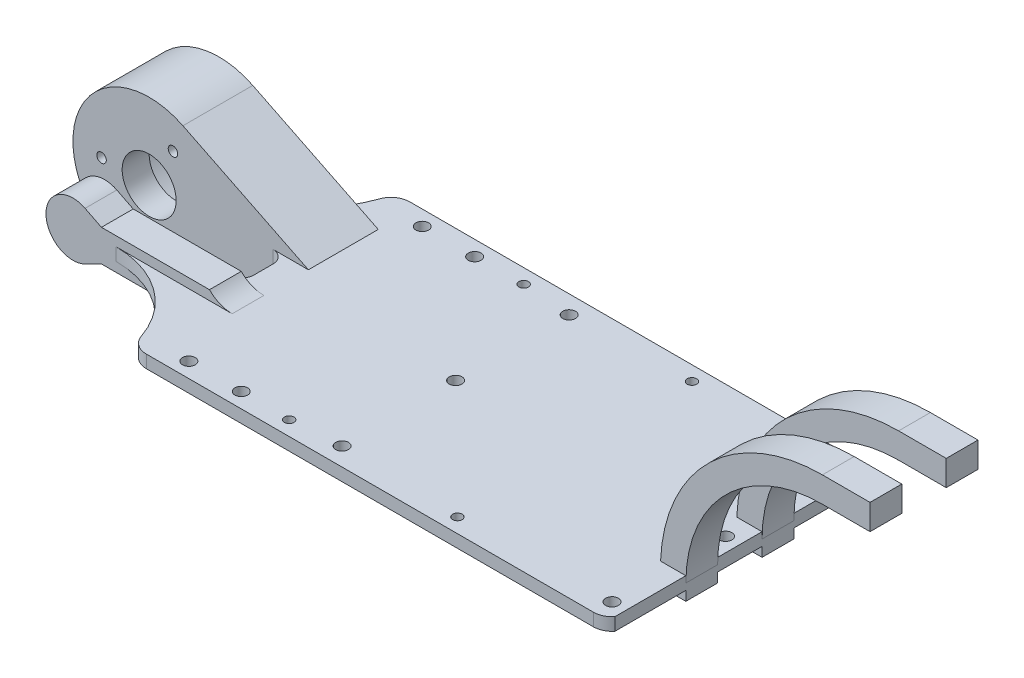
from build123d import *

# Parameters (mm, degrees)
SKETCH1_W                = 49
SKETCH1_H                = 10
BOSS_EXTRUDE1_DEPTH      = 5
BOSS_EXTRUDE1_2_DEPTH    = 5
BOSS_EXTRUDE1_3_DEPTH    = 5
BOSS_EXTRUDE1_4_DEPTH    = 5
CUT_EXTRUDE7_DEPTH       = 129.674006699
CUT_EXTRUDE7_DEPTH_BACK  = 129.674006699
SKETCH2_R                = 2
SKETCH1_3_W              = 150
SKETCH1_3_H              = 83
SKETCH1_3_R              = 2
SKETCH1_3_R_2            = 1.5
BOSS_EXTRUDE2_DEPTH      = 2
FILLET1_R                = 10
SKETCH3_W                = 150
SKETCH3_H                = 10
BOSS_EXTRUDE3_DEPTH      = 3
FILLET2_R                = 30
FILLET3_R                = 4
FILLET4_R                = 6
CUT_EXTRUDE8_DEPTH       = 131.000961535
CUT_EXTRUDE8_DEPTH_BACK  = 131.000961535
SKETCH4_R                = 2
CUT_EXTRUDE11_DEPTH      = 10
CUT_EXTRUDE11_DEPTH_BACK = 10
SKETCH7_W                = 28.430899549
SKETCH7_H                = 10.310755735
BOSS_EXTRUDE4_START      = -10
SKETCH6_R                = 21.075
SKETCH6_R_2              = 1.5
SKETCH6_R_3              = 8.5
BOSS_EXTRUDE4_DEPTH      = 22
SKETCH9_R                = 2
BOSS_EXTRUDE5_DEPTH      = 10
CUT_EXTRUDE12_START      = -10
SKETCH9_4_R              = 2
CUT_EXTRUDE12_DEPTH      = 4.2
CUT_EXTRUDE13_START      = -1.5
SKETCH6_3_R              = 21.075
SKETCH6_3_R_2            = 1.5
SKETCH6_3_R_3            = 8.5
CUT_EXTRUDE13_DEPTH      = 13.5
CUT_EXTRUDE14_DEPTH      = 151.207356677
CUT_EXTRUDE14_DEPTH_BACK = 151.207356677
SKETCH11_W               = 48
SKETCH11_H               = 83
BOSS_EXTRUDE6_START      = 7
BOSS_EXTRUDE6_DEPTH      = 10
BOSS_EXTRUDE7_START      = -17
BOSS_EXTRUDE7_DEPTH      = 10


with BuildPart() as part:
    # Sketch1 → Boss-Extrude1 (new, symmetric)
    with BuildSketch(Plane(origin=(0, 0, 0), x_dir=(1, 0, 0), z_dir=(0, 1, 0))):
        with Locations((-99.5, 12)):
            Rectangle(SKETCH1_W, SKETCH1_H)
    extrude(amount=BOSS_EXTRUDE1_DEPTH, both=True)


with BuildPart() as body_2:
    # Sketch1 → Boss-Extrude1 2 (new, symmetric)
    with BuildSketch(Plane(origin=(0, 0, 0), x_dir=(1, 0, 0), z_dir=(0, 1, 0))):
        with Locations((-99.5, -12)):
            Rectangle(SKETCH1_W, SKETCH1_H)
    extrude(amount=BOSS_EXTRUDE1_2_DEPTH, both=True)


with BuildPart() as body_3:
    # Sketch1 → Boss-Extrude1 3 (new, symmetric)
    with BuildSketch(Plane(origin=(0, 0, 0), x_dir=(1, 0, 0), z_dir=(0, 1, 0))):
        with Locations((99.5, 12)):
            Rectangle(SKETCH1_W, SKETCH1_H)
    extrude(amount=BOSS_EXTRUDE1_3_DEPTH, both=True)


with BuildPart() as body_4:
    # Sketch1 → Boss-Extrude1 4 (new, symmetric)
    with BuildSketch(Plane(origin=(0, 0, 0), x_dir=(1, 0, 0), z_dir=(0, 1, 0))):
        with Locations((99.5, -12)):
            Rectangle(SKETCH1_W, SKETCH1_H)
    extrude(amount=BOSS_EXTRUDE1_4_DEPTH, both=True)


with BuildPart() as cut_extrude7_tool:
    # Sketch2 → Cut-Extrude7 (new, two sides: drawn at the far end of the back side and taken through both)
    with BuildSketch(Plane(origin=(0, 0, -17), x_dir=(-1, 0, 0), z_dir=(0, 0, -1)).offset(-CUT_EXTRUDE7_DEPTH_BACK)):
        with Locations((-118, 0)):
            Circle(SKETCH2_R)
        with Locations((118, 0)):
            Circle(SKETCH2_R)
        with BuildLine():
            Line((-118, 5), (-118, 9.505708739))
            Line((-118, 9.505708739), (-152.726369059, 9.505708739))
            Line((-152.726369059, 9.505708739), (-152.726369059, -6.904283851))
            Line((-152.726369059, -6.904283851), (-118, -6.904283851))
            Line((-118, -6.904283851), (-118, -5))
            ThreePointArc((-118, -5), (-123, 0), (-118, 5))
        make_face()
        with BuildLine():
            Line((118, 5), (118, 9.505708739))
            Line((118, 9.505708739), (152.726369059, 9.505708739))
            Line((152.726369059, 9.505708739), (152.726369059, -6.904283851))
            Line((152.726369059, -6.904283851), (118, -6.904283851))
            Line((118, -6.904283851), (118, -5))
            ThreePointArc((118, -5), (123, 0), (118, 5))
        make_face()
    extrude(amount=CUT_EXTRUDE7_DEPTH + CUT_EXTRUDE7_DEPTH_BACK)


with BuildPart() as part_1:
    add(part.part)

    # Cut-Extrude7: cut by cut_extrude7_tool
    add(cut_extrude7_tool.part, mode=Mode.SUBTRACT)



with BuildPart() as body_2_1:
    add(body_2.part)

    # Cut-Extrude7: cut by cut_extrude7_tool
    add(cut_extrude7_tool.part, mode=Mode.SUBTRACT)


with BuildPart() as body_3_1:
    add(body_3.part)

    # Cut-Extrude7: cut by cut_extrude7_tool
    add(cut_extrude7_tool.part, mode=Mode.SUBTRACT)


with BuildPart() as body_4_1:
    add(body_4.part)

    # Cut-Extrude7: cut by cut_extrude7_tool
    add(cut_extrude7_tool.part, mode=Mode.SUBTRACT)


with BuildPart() as part_2:
    add(part_1.part)

    add(body_2_1.part)  # Boss-Extrude2 merges body 2

    add(body_3_1.part)  # Boss-Extrude2 merges body 3

    add(body_4_1.part)  # Boss-Extrude2 merges body 4
    # Sketch1<3> → Boss-Extrude2 (add, symmetric)
    with BuildSketch(Plane(origin=(0, 0, 0), x_dir=(1, 0, 0), z_dir=(0, 1, 0))):
        Rectangle(SKETCH1_3_W, SKETCH1_3_H)
        with Locations(Location((70.5, 35.75, 0), (0, 0, 270))):
            Circle(SKETCH1_3_R, mode=Mode.SUBTRACT)
        with Locations(Location((70.5, 0, 0), (0, 0, 270))):
            Circle(SKETCH1_3_R, mode=Mode.SUBTRACT)
        with Locations(Location((70.5, -35.75, 0), (0, 0, 270))):
            Circle(SKETCH1_3_R, mode=Mode.SUBTRACT)
        with Locations(Location((-14.5, -35.75, 0), (0, 0, 270))):
            Circle(SKETCH1_3_R, mode=Mode.SUBTRACT)
        with Locations(Location((-14.5, 0, 0), (0, 0, 270))):
            Circle(SKETCH1_3_R, mode=Mode.SUBTRACT)
        with Locations(Location((-14.5, 35.75, 0), (0, 0, 270))):
            Circle(SKETCH1_3_R, mode=Mode.SUBTRACT)
        with Locations(Location((-30, -36.93, 0), (0, 0, 270))):
            Circle(SKETCH1_3_R_2, mode=Mode.SUBTRACT)
        with Locations(Location((23, -36.93, 0), (0, 0, 270))):
            Circle(SKETCH1_3_R_2, mode=Mode.SUBTRACT)
        with Locations(Location((23, 36.93, 0), (0, 0, 270))):
            Circle(SKETCH1_3_R_2, mode=Mode.SUBTRACT)
        with Locations(Location((-30, 36.93, 0), (0, 0, 270))):
            Circle(SKETCH1_3_R_2, mode=Mode.SUBTRACT)
    extrude(amount=BOSS_EXTRUDE2_DEPTH, both=True)

    # Fillet1
    # the kernel refuses this fillet: 10 mm, written as the material it adds along each edge
    with BuildSketch(Plane(origin=(-75, 2, -17), x_dir=(0, 1, 0), z_dir=(0, 0, 1))) as fillet1_piece_1:
        with BuildLine():
            CenterArc((10, -7.141428429), FILLET1_R, 134.427004001, 45.572995999)
            Line((0, -7.141428429), (0, 0))
            Line((0, 0), (3, 0))
        make_face()
    extrude(amount=10)
    with BuildSketch(Plane(origin=(-75, 2, -34.853571071), x_dir=(0, 1, 0), z_dir=(0, 0, 1))) as fillet1_piece_2_section:
        with BuildLine():
            CenterArc((10, -7.141428429), FILLET1_R, 134.427004001, 45.572995999)
            Line((0, -7.141428429), (0, 0))
            Line((0, 0), (3, 0))
        make_face()
    fillet1_piece_2 = extrude(amount=45.707142143, mode=Mode.PRIVATE)
    fillet1_piece_2 = split(fillet1_piece_2, bisect_by=Plane(origin=(-71.739300884, 2.762016454, 7), z_dir=(0, 0, 1)), keep=Keep.TOP, mode=Mode.PRIVATE)
    add(fillet1_piece_2)
    with BuildSketch(Plane(origin=(-75, 2, -10.853571071), x_dir=(1, 0, 0), z_dir=(0, 0, 1))) as fillet1_piece_3_section:
        with BuildLine():
            CenterArc((7.141428429, 10), FILLET1_R, 224.427004001, 45.572995999)
            Line((0, 3), (0, 0))
            Line((0, 0), (7.141428429, 0))
        make_face()
    fillet1_piece_3 = extrude(amount=45.707142143, mode=Mode.PRIVATE)
    fillet1_piece_3 = split(fillet1_piece_3, bisect_by=Plane(origin=(-71.739300884, 2.762016454, -7), z_dir=(0, 0, -1)), keep=Keep.TOP, mode=Mode.PRIVATE)
    add(fillet1_piece_3)
    with BuildSketch(Plane(origin=(-75, 2, 7), x_dir=(1, 0, 0), z_dir=(0, 0, 1)), Plane(origin=(75, 2, 17), x_dir=(-1, 0, 0), z_dir=(0, 0, -1)), Plane(origin=(75, 2, -7), x_dir=(-1, 0, 0), z_dir=(0, 0, -1))) as fillet1_piece_4:
        with BuildLine():
            CenterArc((7.141428429, 10), FILLET1_R, 224.427004001, 45.572995999)
            Line((0, 3), (0, 0))
            Line((0, 0), (7.141428429, 0))
        make_face()
    extrude(amount=10)
    with BuildSketch(Plane(origin=(75, 2, 34.853571071), x_dir=(-1, 0, 0), z_dir=(0, 0, -1))) as fillet1_piece_5_section:
        with BuildLine():
            CenterArc((7.141428429, 10), FILLET1_R, 224.427004001, 45.572995999)
            Line((0, 3), (0, 0))
            Line((0, 0), (7.141428429, 0))
        make_face()
    fillet1_piece_5 = extrude(amount=45.707142143, mode=Mode.PRIVATE)
    fillet1_piece_5 = split(fillet1_piece_5, bisect_by=Plane(origin=(71.739300884, 2.762016454, -7), z_dir=(0, 0, -1)), keep=Keep.TOP, mode=Mode.PRIVATE)
    add(fillet1_piece_5)
    with BuildSketch(Plane(origin=(75, 2, 10.853571071), x_dir=(-1, 0, 0), z_dir=(0, 0, -1))) as fillet1_piece_6_section:
        with BuildLine():
            CenterArc((7.141428429, 10), FILLET1_R, 224.427004001, 45.572995999)
            Line((0, 3), (0, 0))
            Line((0, 0), (7.141428429, 0))
        make_face()
    fillet1_piece_6 = extrude(amount=45.707142143, mode=Mode.PRIVATE)
    fillet1_piece_6 = split(fillet1_piece_6, bisect_by=Plane(origin=(71.739300884, 2.762016454, 7), z_dir=(0, 0, 1)), keep=Keep.TOP, mode=Mode.PRIVATE)
    add(fillet1_piece_6)

    # Sketch3 → Boss-Extrude3 (add)
    with BuildSketch(Plane.XZ.offset(2)):
        with Locations((0, 12)):
            Rectangle(SKETCH3_W, SKETCH3_H)
        with Locations((0, -12)):
            Rectangle(SKETCH3_W, SKETCH3_H)
    extrude(amount=BOSS_EXTRUDE3_DEPTH)

    # Fillet2
    # the kernel refuses this fillet: 30 mm, written as the material it adds along each edge
    with BuildSketch(Plane(origin=(-75, 2, 17), x_dir=(-1, 0, 0), z_dir=(0, -1, 0)), Plane(origin=(75, -2, 17), x_dir=(1, 0, 0), z_dir=(0, 1, 0))) as fillet2_piece_1:
        with BuildLine():
            CenterArc((29.491524206, -30), FILLET2_R, 90, 79.436022411)
            Line((0, -24.5), (-0.589830484, -24.39))
            ThreePointArc((-0.589830484, -24.39), (-0.6, -12.25), (-0.6, 0))
            Line((-0.6, 0), (0, 0.6))
            Line((0, 0.6), (29.491524206, 0.6))
            Line((29.491524206, 0.6), (29.491524206, 0))
        make_face()
    extrude(amount=4)
    with BuildSketch(Plane(origin=(-75, -2, -17), x_dir=(0, 0, -1), z_dir=(0, 1, 0)), Plane(origin=(75, 2, -17), x_dir=(0, 0, -1), z_dir=(0, -1, 0))) as fillet2_piece_2:
        with BuildLine():
            CenterArc((30, 29.491524206), FILLET2_R, 180, 79.436022411)
            Line((0, 29.491524206), (-0.6, 29.491524206))
            Line((-0.6, 29.491524206), (-0.6, 0))
            Line((-0.6, 0), (0, -0.6))
            ThreePointArc((0, -0.6), (12.25, -0.6), (24.39, -0.589830484))
            Line((24.39, -0.589830484), (24.5, 0))
        make_face()
    extrude(amount=4)

    # Fillet3
    fillet3_edges = [part_2.edges().sort_by_distance(p)[0] for p in [
        (-75, 0, 7),
        (75, 0, -7),
        (75, 0, 7),
        (-75, 0, -7),
    ]]
    fillet(fillet3_edges, radius=FILLET3_R)

    # Fillet4
    fillet4_edges = [part_2.edges().sort_by_distance(p)[0] for p in [
        (-75, 0, -41.5),
        (-75, 0, 41.5),
        (75, 0, 41.5),
        (75, 0, -41.5),
    ]]
    fillet(fillet4_edges, radius=FILLET4_R)

    # Sketch4 → Cut-Extrude8 (cut, two sides: drawn at the far end of the back side and taken through both)
    with BuildSketch(Plane(origin=(0, 2, 0), x_dir=(1, 0, 0), z_dir=(0, 1, 0)).offset(-CUT_EXTRUDE8_DEPTH_BACK)):
        with Locations(Location((-45.25, -36.75, 0), (0, 0, 270))):
            Circle(SKETCH4_R)
        with Locations(Location((-61.75, -36.75, 0), (0, 0, 270))):
            Circle(SKETCH4_R)
        with Locations(Location((-45.25, 36.75, 0), (0, 0, 270))):
            Circle(SKETCH4_R)
        with Locations(Location((-61.75, 36.75, 0), (0, 0, 270))):
            Circle(SKETCH4_R)
    extrude(amount=CUT_EXTRUDE8_DEPTH + CUT_EXTRUDE8_DEPTH_BACK, mode=Mode.SUBTRACT)

    # Sketch7 → Cut-Extrude11 (cut, two sides: drawn at the far end of the back side and taken through both)
    with BuildSketch(Plane(origin=(0, 0, -17), x_dir=(-1, 0, 0), z_dir=(0, 0, -1)).offset(-CUT_EXTRUDE11_DEPTH_BACK)):
        with Locations((109.035286033, -0.155377868)):
            Rectangle(SKETCH7_W, SKETCH7_H)
    extrude(amount=CUT_EXTRUDE11_DEPTH + CUT_EXTRUDE11_DEPTH_BACK, mode=Mode.SUBTRACT)

    # Sketch6 → Boss-Extrude4 (add)
    # profile 1 of 6: a face of its own
    with BuildSketch(Plane(origin=(0, 0, -17), x_dir=(-1, 0, 0), z_dir=(0, 0, -1)).offset(BOSS_EXTRUDE4_START)):
        with BuildLine():
            ThreePointArc((142, 0), (130.666861261, 20.385058886), (107.370781183, 21.517892726))
            ThreePointArc((107.370781183, 21.517892726), (97.104429588, 11.805724763), (94.083478514, -2))
            Line((94.083478514, -2), (94.819836258, -2))
            Line((94.819836258, -2), (94.819836258, -5))
            Line((94.819836258, -5), (94.526610811, -5))
            ThreePointArc((94.526610811, -5), (99.053835132, -14.732373766), (107.370781183, -21.517892726))
            ThreePointArc((107.370781183, -21.517892726), (130.666861261, -20.385058886), (142, 0))
        make_face()
        with Locations((118, 0)):
            Circle(SKETCH6_R, mode=Mode.SUBTRACT)
    # profile 2 of 6: a face of its own
    with BuildSketch(Plane(origin=(0, 0, -17), x_dir=(-1, 0, 0), z_dir=(0, 0, -1)).offset(BOSS_EXTRUDE4_START)):
        with Locations((118, 0)):
            Circle(SKETCH6_R)
        with Locations(Location((110.5, -12.990381057, 0), (0, 0, 180))):
            Circle(SKETCH6_R_2, mode=Mode.SUBTRACT)
        with Locations(Location((110.5, 12.990381057, 0), (0, 0, 180))):
            Circle(SKETCH6_R_2, mode=Mode.SUBTRACT)
        with Locations(Location((133, 0, 0), (0, 0, 180))):
            Circle(SKETCH6_R_2, mode=Mode.SUBTRACT)
        with Locations(Location((118, 0, 0), (0, 0, 180))):
            Circle(SKETCH6_R_3, mode=Mode.SUBTRACT)
    # profile 3 of 6: a face of its own
    with BuildSketch(Plane(origin=(0, 0, -17), x_dir=(-1, 0, 0), z_dir=(0, 0, -1)).offset(BOSS_EXTRUDE4_START)):
        with BuildLine():
            Line((73.931800403, -5), (107.370781183, -21.517892726))
            ThreePointArc((107.370781183, -21.517892726), (99.053835132, -14.732373766), (94.526610811, -5))
            Line((94.526610811, -5), (73.931800403, -5))
        make_face()
    # profile 4 of 6: a face of its own
    with BuildSketch(Plane(origin=(0, 0, -17), x_dir=(-1, 0, 0), z_dir=(0, 0, -1)).offset(BOSS_EXTRUDE4_START)):
        with BuildLine():
            ThreePointArc((94.083478514, -2), (97.104429588, 11.805724763), (107.370781183, 21.517892726))
            Line((107.370781183, 21.517892726), (67.858571571, 2))
            Line((67.858571571, 2), (67.858571571, -2))
            Line((67.858571571, -2), (94.083478514, -2))
        make_face()
    # profile 5 of 6: a face of its own
    with BuildSketch(Plane(origin=(0, 0, -17), x_dir=(-1, 0, 0), z_dir=(0, 0, -1)).offset(BOSS_EXTRUDE4_START)):
        with BuildLine():
            ThreePointArc((94.526610811, -5), (94.257613674, -3.507006068), (94.083478514, -2))
            Line((94.083478514, -2), (67.858571571, -2))
            Line((67.858571571, -2), (73.931800403, -5))
            Line((73.931800403, -5), (94.526610811, -5))
        make_face()
    # profile 6 of 6: a face of its own
    with BuildSketch(Plane(origin=(0, 0, -17), x_dir=(-1, 0, 0), z_dir=(0, 0, -1)).offset(BOSS_EXTRUDE4_START)):
        with BuildLine():
            Line((94.819836258, -2), (94.083478514, -2))
            ThreePointArc((94.083478514, -2), (94.257613674, -3.507006068), (94.526610811, -5))
            Line((94.526610811, -5), (94.819836258, -5))
            Line((94.819836258, -5), (94.819836258, -2))
        make_face()
    extrude(amount=BOSS_EXTRUDE4_DEPTH)

    # Sketch9 → Boss-Extrude5 (add)
    # profile 1 of 10: a face of its own
    with BuildSketch(Plane.XY.offset(17)):
        with BuildLine():
            Line((-103.054202201, 2), (-109.021632678, 5))
            Line((-109.021632678, 5), (-111.126136458, 5))
            ThreePointArc((-111.126136458, 5), (-109.91675065, 2.628893293), (-109.5, 0))
            ThreePointArc((-109.5, 0), (-109.91675065, -2.628893293), (-111.126136458, -5))
            Line((-111.126136458, -5), (-109.021632678, -5))
            Line((-109.021632678, -5), (-103.054202201, -2))
            Line((-103.054202201, -2), (-104.491524206, -2))
            Line((-104.491524206, -2), (-104.491524206, 2))
            Line((-104.491524206, 2), (-103.054202201, 2))
        make_face()
    # profile 2 of 10: a face of its own
    with BuildSketch(Plane.XY.offset(17)):
        with BuildLine():
            ThreePointArc((-111.126136458, 5), (-112.498999561, 6.479891524), (-114.182113913, 7.594323263))
            ThreePointArc((-114.182113913, 7.594323263), (-126.5, 0), (-114.182113913, -7.594323263))
            ThreePointArc((-114.182113913, -7.594323263), (-112.498999561, -6.479891524), (-111.126136458, -5))
            Line((-111.126136458, -5), (-114.167246421, -5))
            ThreePointArc((-114.167246421, -5), (-124.3, 0), (-114.167246421, 5))
            Line((-114.167246421, 5), (-111.126136458, 5))
        make_face()
    # profile 3 of 10: a face of its own
    with BuildSketch(Plane.XY.offset(17)):
        with BuildLine():
            ThreePointArc((-109.5, 0), (-109.91675065, 2.628893293), (-111.126136458, 5))
            Line((-111.126136458, 5), (-114.167246421, 5))
            ThreePointArc((-114.167246421, 5), (-112.350382865, 2.787799531), (-111.7, 0))
            ThreePointArc((-111.7, 0), (-112.350382865, -2.787799531), (-114.167246421, -5))
            Line((-114.167246421, -5), (-111.126136458, -5))
            ThreePointArc((-111.126136458, -5), (-109.91675065, -2.628893293), (-109.5, 0))
        make_face()
    # profile 4 of 10: a face of its own
    with BuildSketch(Plane.XY.offset(17)):
        with BuildLine():
            ThreePointArc((-111.7, 0), (-112.350382865, 2.787799531), (-114.167246421, 5))
            Line((-114.167246421, 5), (-118, 5))
            ThreePointArc((-118, 5), (-123, 0), (-118, -5))
            Line((-118, -5), (-114.167246421, -5))
            ThreePointArc((-114.167246421, -5), (-112.350382865, -2.787799531), (-111.7, 0))
        make_face()
        with Locations((-118, 0)):
            Circle(SKETCH9_R, mode=Mode.SUBTRACT)
    # profile 5 of 10: a face of its own
    with BuildSketch(Plane.XY.offset(17)):
        with BuildLine():
            Line((-118, 5), (-114.167246421, 5))
            ThreePointArc((-114.167246421, 5), (-124.3, 0), (-114.167246421, -5))
            Line((-114.167246421, -5), (-118, -5))
            ThreePointArc((-118, -5), (-123, 0), (-118, 5))
        make_face()
    # profile 6 of 10: a face of its own
    with BuildSketch(Plane.XY.offset(17)):
        with BuildLine():
            ThreePointArc((-111.126136458, 5), (-112.498999561, 6.479891524), (-114.182113913, 7.594323263))
            ThreePointArc((-114.182113913, 7.594323263), (-126.5, 0), (-114.182113913, -7.594323263))
            ThreePointArc((-114.182113913, -7.594323263), (-112.498999561, -6.479891524), (-111.126136458, -5))
            Line((-111.126136458, -5), (-114.167246421, -5))
            ThreePointArc((-114.167246421, -5), (-124.3, 0), (-114.167246421, 5))
            Line((-114.167246421, 5), (-111.126136458, 5))
        make_face()
    # profile 7 of 10: a face of its own
    with BuildSketch(Plane.XY.offset(17)):
        with BuildLine():
            ThreePointArc((-109.5, 0), (-109.91675065, 2.628893293), (-111.126136458, 5))
            Line((-111.126136458, 5), (-114.167246421, 5))
            ThreePointArc((-114.167246421, 5), (-112.350382865, 2.787799531), (-111.7, 0))
            ThreePointArc((-111.7, 0), (-112.350382865, -2.787799531), (-114.167246421, -5))
            Line((-114.167246421, -5), (-111.126136458, -5))
            ThreePointArc((-111.126136458, -5), (-109.91675065, -2.628893293), (-109.5, 0))
        make_face()
    # profile 8 of 10: a face of its own
    with BuildSketch(Plane.XY.offset(17)):
        with BuildLine():
            Line((-109.021632678, 5), (-114.182113913, 7.594323263))
            ThreePointArc((-114.182113913, 7.594323263), (-112.498999561, 6.479891524), (-111.126136458, 5))
            Line((-111.126136458, 5), (-109.021632678, 5))
        make_face()
    # profile 9 of 10: a face of its own
    with BuildSketch(Plane.XY.offset(17)):
        with BuildLine():
            ThreePointArc((-111.126136458, -5), (-112.498999561, -6.479891524), (-114.182113913, -7.594323263))
            Line((-114.182113913, -7.594323263), (-109.021632678, -5))
            Line((-109.021632678, -5), (-111.126136458, -5))
        make_face()
    # profile 10 of 10: a face of its own
    with BuildSketch(Plane.XY.offset(17)):
        with Locations((-118, 0)):
            Circle(SKETCH9_R)
    extrude(amount=-BOSS_EXTRUDE5_DEPTH)

    # Sketch9<4> → Cut-Extrude12 (cut)
    # profile 1 of 3: a face of its own
    with BuildSketch(Plane.XY.offset(17).offset(CUT_EXTRUDE12_START)):
        with BuildLine():
            Line((-118, 5), (-114.167246421, 5))
            ThreePointArc((-114.167246421, 5), (-124.3, 0), (-114.167246421, -5))
            Line((-114.167246421, -5), (-118, -5))
            ThreePointArc((-118, -5), (-123, 0), (-118, 5))
        make_face()
    # profile 2 of 3: a face of its own
    with BuildSketch(Plane.XY.offset(17).offset(CUT_EXTRUDE12_START)):
        with BuildLine():
            ThreePointArc((-111.7, 0), (-112.350382865, 2.787799531), (-114.167246421, 5))
            Line((-114.167246421, 5), (-118, 5))
            ThreePointArc((-118, 5), (-123, 0), (-118, -5))
            Line((-118, -5), (-114.167246421, -5))
            ThreePointArc((-114.167246421, -5), (-112.350382865, -2.787799531), (-111.7, 0))
        make_face()
        with Locations((-118, 0)):
            Circle(SKETCH9_4_R, mode=Mode.SUBTRACT)
    # profile 3 of 3: a face of its own
    with BuildSketch(Plane.XY.offset(17).offset(CUT_EXTRUDE12_START)):
        with Locations((-118, 0)):
            Circle(SKETCH9_4_R)
    extrude(amount=CUT_EXTRUDE12_DEPTH, mode=Mode.SUBTRACT)

    # Sketch6<3> → Cut-Extrude13 (cut)
    with BuildSketch(Plane(origin=(0, 0, -17), x_dir=(-1, 0, 0), z_dir=(0, 0, -1)).offset(CUT_EXTRUDE13_START)):
        with Locations(Location((118, 0, 0), (0, 0, 180))):
            Circle(SKETCH6_3_R)
        with Locations(Location((110.5, -12.990381057, 0), (0, 0, 180))):
            Circle(SKETCH6_3_R_2, mode=Mode.SUBTRACT)
        with Locations(Location((110.5, 12.990381057, 0), (0, 0, 180))):
            Circle(SKETCH6_3_R_2, mode=Mode.SUBTRACT)
        with Locations(Location((133, 0, 0), (0, 0, 180))):
            Circle(SKETCH6_3_R_2, mode=Mode.SUBTRACT)
        with Locations(Location((118, 0, 0), (0, 0, 180))):
            Circle(SKETCH6_3_R_3, mode=Mode.SUBTRACT)
    extrude(amount=CUT_EXTRUDE13_DEPTH, mode=Mode.SUBTRACT)

    # Sketch11 → Cut-Extrude14 (cut, two sides: drawn at the far end of the back side and taken through both)
    with BuildSketch(Plane(origin=(0, 2, 0), x_dir=(1, 0, 0), z_dir=(0, 1, 0)).offset(-CUT_EXTRUDE14_DEPTH_BACK)):
        with Locations((99, 0)):
            Rectangle(SKETCH11_W, SKETCH11_H)
    extrude(amount=CUT_EXTRUDE14_DEPTH + CUT_EXTRUDE14_DEPTH_BACK, mode=Mode.SUBTRACT)

    # Sketch14 → Boss-Extrude6 (add)
    with BuildSketch(Plane.XY.offset(BOSS_EXTRUDE6_START)):
        with BuildLine():
            Line((67, 0), (75, 0))
            ThreePointArc((75, 0), (87.594408409, 30.405591591), (118, 43))
            Line((118, 43), (133, 43))
            Line((133, 43), (133, 51))
            Line((133, 51), (118, 51))
            ThreePointArc((118, 51), (81.937554159, 36.062445841), (67, 0))
        make_face()
    extrude(amount=BOSS_EXTRUDE6_DEPTH)

    # Sketch14<2> → Boss-Extrude7 (add)
    with BuildSketch(Plane.XY.offset(BOSS_EXTRUDE7_START)):
        with BuildLine():
            Line((67, 0), (75, 0))
            ThreePointArc((75, 0), (87.594408409, 30.405591591), (118, 43))
            Line((118, 43), (133, 43))
            Line((133, 43), (133, 51))
            Line((133, 51), (118, 51))
            ThreePointArc((118, 51), (81.937554159, 36.062445841), (67, 0))
        make_face()
    extrude(amount=BOSS_EXTRUDE7_DEPTH)


solid = part_2.part
